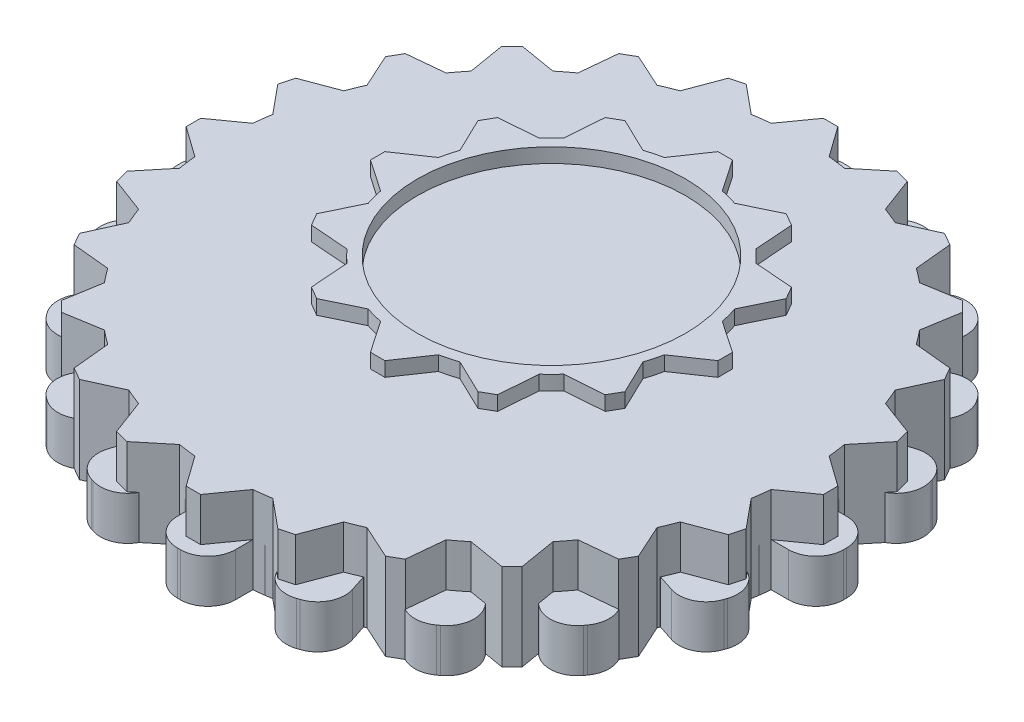
from build123d import *

# Parameters (mm, degrees)
BOSS_EXTRUDE3_DEPTH = 3
BOSS_EXTRUDE5_DEPTH = 6
BOSS_EXTRUDE6_DEPTH = 5.5
SKETCH6_R           = 9.25
BOSS_EXTRUDE7_DEPTH = 1.5


with BuildPart() as part:
    # Sketch2 → Boss-Extrude3 (new body)
    with BuildSketch(Plane(origin=(0, 0, 0), x_dir=(1, 0, 0), z_dir=(0, 1, 0))):
        with BuildLine():
            Line((-23, 0.1), (-23, -0.1))
            ThreePointArc((-23, -0.1), (-22.443502884, -1.443502884), (-21.1, -2))
            Line((-21.1, -2), (-19.899748742, -2))
            ThreePointArc((-19.899748742, -2), (-19.753766812, -3.128689301), (-19.543819703, -4.247247513))
            Line((-19.543819703, -4.247247513), (-20.685326483, -4.618145549))
            ThreePointArc((-20.685326483, -4.618145549), (-21.791106589, -5.56257098), (-21.905201574, -7.012285219))
            Line((-21.905201574, -7.012285219), (-21.843398175, -7.202496522))
            ThreePointArc((-21.843398175, -7.202496522), (-20.898972744, -8.308276629), (-19.449258505, -8.422371614))
            Line((-19.449258505, -8.422371614), (-18.307751725, -8.051473578))
            ThreePointArc((-18.307751725, -8.051473578), (-17.820130484, -9.079809995), (-17.274805421, -10.078744846))
            Line((-17.274805421, -10.078744846), (-18.245829086, -10.784234835))
            ThreePointArc((-18.245829086, -10.784234835), (-19.005644954, -12.02414164), (-18.666169396, -13.438159103))
            Line((-18.666169396, -13.438159103), (-18.548612345, -13.599962502))
            ThreePointArc((-18.548612345, -13.599962502), (-17.30870554, -14.35977837), (-15.894688077, -14.020302812))
            Line((-15.894688077, -14.020302812), (-14.923664412, -13.314812824))
            ThreePointArc((-14.923664412, -13.314812824), (-14.142135624, -14.142135624), (-13.314812824, -14.923664412))
            Line((-13.314812824, -14.923664412), (-14.020302812, -15.894688077))
            ThreePointArc((-14.020302812, -15.894688077), (-14.35977837, -17.30870554), (-13.599962502, -18.548612345))
            Line((-13.599962502, -18.548612345), (-13.438159103, -18.666169396))
            ThreePointArc((-13.438159103, -18.666169396), (-12.02414164, -19.005644954), (-10.784234835, -18.245829086))
            Line((-10.784234835, -18.245829086), (-10.078744846, -17.274805421))
            ThreePointArc((-10.078744846, -17.274805421), (-9.079809995, -17.820130484), (-8.051473578, -18.307751725))
            Line((-8.051473578, -18.307751725), (-8.422371614, -19.449258505))
            ThreePointArc((-8.422371614, -19.449258505), (-8.308276629, -20.898972744), (-7.202496522, -21.843398175))
            Line((-7.202496522, -21.843398175), (-7.012285219, -21.905201574))
            ThreePointArc((-7.012285219, -21.905201574), (-5.56257098, -21.791106589), (-4.618145549, -20.685326483))
            Line((-4.618145549, -20.685326483), (-4.247247513, -19.543819703))
            ThreePointArc((-4.247247513, -19.543819703), (-3.128689301, -19.753766812), (-2, -19.899748742))
            Line((-2, -19.899748742), (-2, -21.1))
            ThreePointArc((-2, -21.1), (-1.443502884, -22.443502884), (-0.1, -23))
            Line((-0.1, -23), (0.1, -23))
            ThreePointArc((0.1, -23), (1.443502884, -22.443502884), (2, -21.1))
            Line((2, -21.1), (2, -19.899748742))
            ThreePointArc((2, -19.899748742), (3.128689301, -19.753766812), (4.247247513, -19.543819703))
            Line((4.247247513, -19.543819703), (4.618145549, -20.685326483))
            ThreePointArc((4.618145549, -20.685326483), (5.56257098, -21.791106589), (7.012285219, -21.905201574))
            Line((7.012285219, -21.905201574), (7.202496522, -21.843398175))
            ThreePointArc((7.202496522, -21.843398175), (8.308276629, -20.898972744), (8.422371614, -19.449258505))
            Line((8.422371614, -19.449258505), (8.051473578, -18.307751725))
            ThreePointArc((8.051473578, -18.307751725), (9.079809995, -17.820130484), (10.078744846, -17.274805421))
            Line((10.078744846, -17.274805421), (10.784234835, -18.245829086))
            ThreePointArc((10.784234835, -18.245829086), (12.02414164, -19.005644954), (13.438159103, -18.666169396))
            Line((13.438159103, -18.666169396), (13.599962502, -18.548612345))
            ThreePointArc((13.599962502, -18.548612345), (14.35977837, -17.30870554), (14.020302812, -15.894688077))
            Line((14.020302812, -15.894688077), (13.314812824, -14.923664412))
            ThreePointArc((13.314812824, -14.923664412), (14.142135624, -14.142135624), (14.923664412, -13.314812824))
            Line((14.923664412, -13.314812824), (15.894688077, -14.020302812))
            ThreePointArc((15.894688077, -14.020302812), (17.30870554, -14.35977837), (18.548612345, -13.599962502))
            Line((18.548612345, -13.599962502), (18.666169396, -13.438159103))
            ThreePointArc((18.666169396, -13.438159103), (19.005644954, -12.02414164), (18.245829086, -10.784234835))
            Line((18.245829086, -10.784234835), (17.274805421, -10.078744846))
            ThreePointArc((17.274805421, -10.078744846), (17.820130484, -9.079809995), (18.307751725, -8.051473578))
            Line((18.307751725, -8.051473578), (19.449258505, -8.422371614))
            ThreePointArc((19.449258505, -8.422371614), (20.898972744, -8.308276629), (21.843398175, -7.202496522))
            Line((21.843398175, -7.202496522), (21.905201574, -7.012285219))
            ThreePointArc((21.905201574, -7.012285219), (21.791106589, -5.56257098), (20.685326483, -4.618145549))
            Line((20.685326483, -4.618145549), (19.543819703, -4.247247513))
            ThreePointArc((19.543819703, -4.247247513), (19.753766812, -3.128689301), (19.899748742, -2))
            Line((19.899748742, -2), (21.1, -2))
            ThreePointArc((21.1, -2), (22.443502884, -1.443502884), (23, -0.1))
            Line((23, -0.1), (23, 0.1))
            ThreePointArc((23, 0.1), (22.443502884, 1.443502884), (21.1, 2))
            Line((21.1, 2), (19.899748742, 2))
            ThreePointArc((19.899748742, 2), (19.753766812, 3.128689301), (19.543819703, 4.247247513))
            Line((19.543819703, 4.247247513), (20.685326483, 4.618145549))
            ThreePointArc((20.685326483, 4.618145549), (21.791106589, 5.56257098), (21.905201574, 7.012285219))
            Line((21.905201574, 7.012285219), (21.843398175, 7.202496522))
            ThreePointArc((21.843398175, 7.202496522), (20.898972744, 8.308276629), (19.449258505, 8.422371614))
            Line((19.449258505, 8.422371614), (18.307751725, 8.051473578))
            ThreePointArc((18.307751725, 8.051473578), (17.820130484, 9.079809995), (17.274805421, 10.078744846))
            Line((17.274805421, 10.078744846), (18.245829086, 10.784234835))
            ThreePointArc((18.245829086, 10.784234835), (19.005644954, 12.02414164), (18.666169396, 13.438159103))
            Line((18.666169396, 13.438159103), (18.548612345, 13.599962502))
            ThreePointArc((18.548612345, 13.599962502), (17.30870554, 14.35977837), (15.894688077, 14.020302812))
            Line((15.894688077, 14.020302812), (14.923664412, 13.314812824))
            ThreePointArc((14.923664412, 13.314812824), (14.142135624, 14.142135624), (13.314812824, 14.923664412))
            Line((13.314812824, 14.923664412), (14.020302812, 15.894688077))
            ThreePointArc((14.020302812, 15.894688077), (14.35977837, 17.30870554), (13.599962502, 18.548612345))
            Line((13.599962502, 18.548612345), (13.438159103, 18.666169396))
            ThreePointArc((13.438159103, 18.666169396), (12.02414164, 19.005644954), (10.784234835, 18.245829086))
            Line((10.784234835, 18.245829086), (10.078744846, 17.274805421))
            ThreePointArc((10.078744846, 17.274805421), (9.079809995, 17.820130484), (8.051473578, 18.307751725))
            Line((8.051473578, 18.307751725), (8.422371614, 19.449258505))
            ThreePointArc((8.422371614, 19.449258505), (8.308276629, 20.898972744), (7.202496522, 21.843398175))
            Line((7.202496522, 21.843398175), (7.012285219, 21.905201574))
            ThreePointArc((7.012285219, 21.905201574), (5.56257098, 21.791106589), (4.618145549, 20.685326483))
            Line((4.618145549, 20.685326483), (4.247247513, 19.543819703))
            ThreePointArc((4.247247513, 19.543819703), (3.128689301, 19.753766812), (2, 19.899748742))
            Line((2, 19.899748742), (2, 21.1))
            ThreePointArc((2, 21.1), (1.443502884, 22.443502884), (0.1, 23))
            Line((0.1, 23), (-0.1, 23))
            ThreePointArc((-0.1, 23), (-1.443502884, 22.443502884), (-2, 21.1))
            Line((-2, 21.1), (-2, 19.899748742))
            ThreePointArc((-2, 19.899748742), (-3.128689301, 19.753766812), (-4.247247513, 19.543819703))
            Line((-4.247247513, 19.543819703), (-4.618145549, 20.685326483))
            ThreePointArc((-4.618145549, 20.685326483), (-5.56257098, 21.791106589), (-7.012285219, 21.905201574))
            Line((-7.012285219, 21.905201574), (-7.202496522, 21.843398175))
            ThreePointArc((-7.202496522, 21.843398175), (-8.308276629, 20.898972744), (-8.422371614, 19.449258505))
            Line((-8.422371614, 19.449258505), (-8.051473578, 18.307751725))
            ThreePointArc((-8.051473578, 18.307751725), (-9.079809995, 17.820130484), (-10.078744846, 17.274805421))
            Line((-10.078744846, 17.274805421), (-10.784234835, 18.245829086))
            ThreePointArc((-10.784234835, 18.245829086), (-12.02414164, 19.005644954), (-13.438159103, 18.666169396))
            Line((-13.438159103, 18.666169396), (-13.599962502, 18.548612345))
            ThreePointArc((-13.599962502, 18.548612345), (-14.35977837, 17.30870554), (-14.020302812, 15.894688077))
            Line((-14.020302812, 15.894688077), (-13.314812824, 14.923664412))
            ThreePointArc((-13.314812824, 14.923664412), (-14.142135624, 14.142135624), (-14.923664412, 13.314812824))
            Line((-14.923664412, 13.314812824), (-15.894688077, 14.020302812))
            ThreePointArc((-15.894688077, 14.020302812), (-17.30870554, 14.35977837), (-18.548612345, 13.599962502))
            Line((-18.548612345, 13.599962502), (-18.666169396, 13.438159103))
            ThreePointArc((-18.666169396, 13.438159103), (-19.005644954, 12.02414164), (-18.245829086, 10.784234835))
            Line((-18.245829086, 10.784234835), (-17.274805421, 10.078744846))
            ThreePointArc((-17.274805421, 10.078744846), (-17.820130484, 9.079809995), (-18.307751725, 8.051473578))
            Line((-18.307751725, 8.051473578), (-19.449258505, 8.422371614))
            ThreePointArc((-19.449258505, 8.422371614), (-20.898972744, 8.308276629), (-21.843398175, 7.202496522))
            Line((-21.843398175, 7.202496522), (-21.905201574, 7.012285219))
            ThreePointArc((-21.905201574, 7.012285219), (-21.791106589, 5.56257098), (-20.685326483, 4.618145549))
            Line((-20.685326483, 4.618145549), (-19.543819703, 4.247247513))
            ThreePointArc((-19.543819703, 4.247247513), (-19.753766812, 3.128689301), (-19.899748742, 2))
            Line((-19.899748742, 2), (-21.1, 2))
            ThreePointArc((-21.1, 2), (-22.443502884, 1.443502884), (-23, 0.1))
        make_face()
    extrude(amount=BOSS_EXTRUDE3_DEPTH)


with BuildPart() as body_2:
    # Sketch3 → Boss-Extrude5 (new body)
    with BuildSketch(Plane(origin=(0, 0, 0), x_dir=(1, 0, 0), z_dir=(0, 1, 0))):
        with BuildLine():
            Line((-22, 0.5), (-22, -0.5))
            Line((-22, -0.5), (-19.899748742, -2))
            ThreePointArc((-19.899748742, -2), (-19.828897227, -2.610523844), (-19.739319337, -3.218582315))
            Line((-19.739319337, -3.218582315), (-21.379777701, -5.211056079))
            Line((-21.379777701, -5.211056079), (-21.120958656, -6.176981905))
            Line((-21.120958656, -6.176981905), (-18.704043156, -7.08228562))
            ThreePointArc((-18.704043156, -7.08228562), (-18.47759065, -7.653668647), (-18.23368794, -8.217823563))
            Line((-18.23368794, -8.217823563), (-19.302558883, -10.566987298))
            Line((-19.302558883, -10.566987298), (-18.802558883, -11.433012702))
            Line((-18.802558883, -11.433012702), (-16.23368794, -11.681925179))
            ThreePointArc((-16.23368794, -11.681925179), (-15.867066806, -12.17522858), (-15.485460842, -12.657033717))
            Line((-15.485460842, -12.657033717), (-15.909902577, -15.202795796))
            Line((-15.909902577, -15.202795796), (-15.202795796, -15.909902577))
            Line((-15.202795796, -15.909902577), (-12.657033717, -15.485460842))
            ThreePointArc((-12.657033717, -15.485460842), (-12.17522858, -15.867066806), (-11.681925179, -16.23368794))
            Line((-11.681925179, -16.23368794), (-11.433012702, -18.802558883))
            Line((-11.433012702, -18.802558883), (-10.566987298, -19.302558883))
            Line((-10.566987298, -19.302558883), (-8.217823563, -18.23368794))
            ThreePointArc((-8.217823563, -18.23368794), (-7.653668647, -18.47759065), (-7.08228562, -18.704043156))
            Line((-7.08228562, -18.704043156), (-6.176981905, -21.120958656))
            Line((-6.176981905, -21.120958656), (-5.211056079, -21.379777701))
            Line((-5.211056079, -21.379777701), (-3.218582315, -19.739319337))
            ThreePointArc((-3.218582315, -19.739319337), (-2.610523844, -19.828897227), (-2, -19.899748742))
            Line((-2, -19.899748742), (-0.5, -22))
            Line((-0.5, -22), (0.5, -22))
            Line((0.5, -22), (2, -19.899748742))
            ThreePointArc((2, -19.899748742), (2.610523844, -19.828897227), (3.218582315, -19.739319337))
            Line((3.218582315, -19.739319337), (5.211056079, -21.379777701))
            Line((5.211056079, -21.379777701), (6.176981905, -21.120958656))
            Line((6.176981905, -21.120958656), (7.08228562, -18.704043156))
            ThreePointArc((7.08228562, -18.704043156), (7.653668647, -18.47759065), (8.217823563, -18.23368794))
            Line((8.217823563, -18.23368794), (10.566987298, -19.302558883))
            Line((10.566987298, -19.302558883), (11.433012702, -18.802558883))
            Line((11.433012702, -18.802558883), (11.681925179, -16.23368794))
            ThreePointArc((11.681925179, -16.23368794), (12.17522858, -15.867066806), (12.657033717, -15.485460842))
            Line((12.657033717, -15.485460842), (15.202795796, -15.909902577))
            Line((15.202795796, -15.909902577), (15.909902577, -15.202795796))
            Line((15.909902577, -15.202795796), (15.485460842, -12.657033717))
            ThreePointArc((15.485460842, -12.657033717), (15.867066806, -12.17522858), (16.23368794, -11.681925179))
            Line((16.23368794, -11.681925179), (18.802558883, -11.433012702))
            Line((18.802558883, -11.433012702), (19.302558883, -10.566987298))
            Line((19.302558883, -10.566987298), (18.23368794, -8.217823563))
            ThreePointArc((18.23368794, -8.217823563), (18.47759065, -7.653668647), (18.704043156, -7.08228562))
            Line((18.704043156, -7.08228562), (21.120958656, -6.176981905))
            Line((21.120958656, -6.176981905), (21.379777701, -5.211056079))
            Line((21.379777701, -5.211056079), (19.739319337, -3.218582315))
            ThreePointArc((19.739319337, -3.218582315), (19.828897227, -2.610523844), (19.899748742, -2))
            Line((19.899748742, -2), (22, -0.5))
            Line((22, -0.5), (22, 0.5))
            Line((22, 0.5), (19.899748742, 2))
            ThreePointArc((19.899748742, 2), (19.828897227, 2.610523844), (19.739319337, 3.218582315))
            Line((19.739319337, 3.218582315), (21.379777701, 5.211056079))
            Line((21.379777701, 5.211056079), (21.120958656, 6.176981905))
            Line((21.120958656, 6.176981905), (18.704043156, 7.08228562))
            ThreePointArc((18.704043156, 7.08228562), (18.47759065, 7.653668647), (18.23368794, 8.217823563))
            Line((18.23368794, 8.217823563), (19.302558883, 10.566987298))
            Line((19.302558883, 10.566987298), (18.802558883, 11.433012702))
            Line((18.802558883, 11.433012702), (16.23368794, 11.681925179))
            ThreePointArc((16.23368794, 11.681925179), (15.867066806, 12.17522858), (15.485460842, 12.657033717))
            Line((15.485460842, 12.657033717), (15.909902577, 15.202795796))
            Line((15.909902577, 15.202795796), (15.202795796, 15.909902577))
            Line((15.202795796, 15.909902577), (12.657033717, 15.485460842))
            ThreePointArc((12.657033717, 15.485460842), (12.17522858, 15.867066806), (11.681925179, 16.23368794))
            Line((11.681925179, 16.23368794), (11.433012702, 18.802558883))
            Line((11.433012702, 18.802558883), (10.566987298, 19.302558883))
            Line((10.566987298, 19.302558883), (8.217823563, 18.23368794))
            ThreePointArc((8.217823563, 18.23368794), (7.653668647, 18.47759065), (7.08228562, 18.704043156))
            Line((7.08228562, 18.704043156), (6.176981905, 21.120958656))
            Line((6.176981905, 21.120958656), (5.211056079, 21.379777701))
            Line((5.211056079, 21.379777701), (3.218582315, 19.739319337))
            ThreePointArc((3.218582315, 19.739319337), (2.610523844, 19.828897227), (2, 19.899748742))
            Line((2, 19.899748742), (0.5, 22))
            Line((0.5, 22), (-0.5, 22))
            Line((-0.5, 22), (-2, 19.899748742))
            ThreePointArc((-2, 19.899748742), (-2.610523844, 19.828897227), (-3.218582315, 19.739319337))
            Line((-3.218582315, 19.739319337), (-5.211056079, 21.379777701))
            Line((-5.211056079, 21.379777701), (-6.176981905, 21.120958656))
            Line((-6.176981905, 21.120958656), (-7.08228562, 18.704043156))
            ThreePointArc((-7.08228562, 18.704043156), (-7.653668647, 18.47759065), (-8.217823563, 18.23368794))
            Line((-8.217823563, 18.23368794), (-10.566987298, 19.302558883))
            Line((-10.566987298, 19.302558883), (-11.433012702, 18.802558883))
            Line((-11.433012702, 18.802558883), (-11.681925179, 16.23368794))
            ThreePointArc((-11.681925179, 16.23368794), (-12.17522858, 15.867066806), (-12.657033717, 15.485460842))
            Line((-12.657033717, 15.485460842), (-15.202795796, 15.909902577))
            Line((-15.202795796, 15.909902577), (-15.909902577, 15.202795796))
            Line((-15.909902577, 15.202795796), (-15.485460842, 12.657033717))
            ThreePointArc((-15.485460842, 12.657033717), (-15.867066806, 12.17522858), (-16.23368794, 11.681925179))
            Line((-16.23368794, 11.681925179), (-18.802558883, 11.433012702))
            Line((-18.802558883, 11.433012702), (-19.302558883, 10.566987298))
            Line((-19.302558883, 10.566987298), (-18.23368794, 8.217823563))
            ThreePointArc((-18.23368794, 8.217823563), (-18.47759065, 7.653668647), (-18.704043156, 7.08228562))
            Line((-18.704043156, 7.08228562), (-21.120958656, 6.176981905))
            Line((-21.120958656, 6.176981905), (-21.379777701, 5.211056079))
            Line((-21.379777701, 5.211056079), (-19.739319337, 3.218582315))
            ThreePointArc((-19.739319337, 3.218582315), (-19.828897227, 2.610523844), (-19.899748742, 2))
            Line((-19.899748742, 2), (-22, 0.5))
        make_face()
    extrude(amount=BOSS_EXTRUDE5_DEPTH)


with BuildPart() as body_3:
    # Sketch1 → Boss-Extrude6 (new body)
    with BuildSketch(Plane(origin=(0, 0, 0), x_dir=(1, 0, 0), z_dir=(0, 1, 0))):
        with BuildLine():
            Line((-1.142396869, 15.366895677), (-0.142396869, 15.366895677))
            Line((-0.142396869, 15.366895677), (1.357603131, 13.164854648))
            ThreePointArc((1.357603131, 13.164854648), (1.945793582, 13.026153939), (2.524531809, 12.852177051))
            Line((2.524531809, 12.852177051), (4.924590429, 14.009200522))
            Line((4.924590429, 14.009200522), (5.790615833, 13.509200522))
            Line((5.790615833, 13.509200522), (5.988633424, 10.852177051))
            ThreePointArc((5.988633424, 10.852177051), (6.428670943, 10.437963488), (6.842884505, 9.99792597))
            Line((6.842884505, 9.99792597), (9.499907976, 9.799908378))
            Line((9.499907976, 9.799908378), (9.999907976, 8.933882975))
            Line((9.999907976, 8.933882975), (8.842884505, 6.533824355))
            ThreePointArc((8.842884505, 6.533824355), (9.016861394, 5.955086128), (9.155562102, 5.366895677))
            Line((9.155562102, 5.366895677), (11.357603131, 3.866895677))
            Line((11.357603131, 3.866895677), (11.357603131, 2.866895677))
            Line((11.357603131, 2.866895677), (9.155562102, 1.366895677))
            ThreePointArc((9.155562102, 1.366895677), (9.016861394, 0.778705226), (8.842884505, 0.199966999))
            Line((8.842884505, 0.199966999), (9.999907976, -2.200091622))
            Line((9.999907976, -2.200091622), (9.499907976, -3.066117025))
            Line((9.499907976, -3.066117025), (6.842884505, -3.264134617))
            ThreePointArc((6.842884505, -3.264134617), (6.428670943, -3.704172135), (5.988633424, -4.118385698))
            Line((5.988633424, -4.118385698), (5.790615833, -6.775409169))
            Line((5.790615833, -6.775409169), (4.924590429, -7.275409169))
            Line((4.924590429, -7.275409169), (2.524531809, -6.118385698))
            ThreePointArc((2.524531809, -6.118385698), (1.945793582, -6.292362586), (1.357603131, -6.431063295))
            Line((1.357603131, -6.431063295), (-0.142396869, -8.633104323))
            Line((-0.142396869, -8.633104323), (-1.142396869, -8.633104323))
            Line((-1.142396869, -8.633104323), (-2.642396869, -6.431063295))
            ThreePointArc((-2.642396869, -6.431063295), (-3.23058732, -6.292362586), (-3.809325547, -6.118385698))
            Line((-3.809325547, -6.118385698), (-6.209384167, -7.275409169))
            Line((-6.209384167, -7.275409169), (-7.075409571, -6.775409169))
            Line((-7.075409571, -6.775409169), (-7.273427162, -4.118385698))
            ThreePointArc((-7.273427162, -4.118385698), (-7.713464681, -3.704172135), (-8.127678243, -3.264134617))
            Line((-8.127678243, -3.264134617), (-10.784701714, -3.066117025))
            Line((-10.784701714, -3.066117025), (-11.284701714, -2.200091622))
            Line((-11.284701714, -2.200091622), (-10.127678243, 0.199966999))
            ThreePointArc((-10.127678243, 0.199966999), (-10.301655132, 0.778705226), (-10.44035584, 1.366895677))
            Line((-10.44035584, 1.366895677), (-12.642396869, 2.866895677))
            Line((-12.642396869, 2.866895677), (-12.642396869, 3.866895677))
            Line((-12.642396869, 3.866895677), (-10.44035584, 5.366895677))
            ThreePointArc((-10.44035584, 5.366895677), (-10.301655132, 5.955086128), (-10.127678243, 6.533824355))
            Line((-10.127678243, 6.533824355), (-11.284701714, 8.933882975))
            Line((-11.284701714, 8.933882975), (-10.784701714, 9.799908378))
            Line((-10.784701714, 9.799908378), (-8.127678243, 9.99792597))
            ThreePointArc((-8.127678243, 9.99792597), (-7.713464681, 10.437963488), (-7.273427162, 10.852177051))
            Line((-7.273427162, 10.852177051), (-7.075409571, 13.509200522))
            Line((-7.075409571, 13.509200522), (-6.209384167, 14.009200522))
            Line((-6.209384167, 14.009200522), (-3.809325547, 12.852177051))
            ThreePointArc((-3.809325547, 12.852177051), (-3.23058732, 13.026153939), (-2.642396869, 13.164854648))
            Line((-2.642396869, 13.164854648), (-1.142396869, 15.366895677))
        make_face()
        with BuildLine():
            Line((-2.642396869, 4.866895677), (1.357603131, 4.866895677))
            ThreePointArc((1.357603131, 4.866895677), (1.857603131, 3.366895677), (1.357603131, 1.866895677))
            Line((1.357603131, 1.866895677), (-2.642396869, 1.866895677))
            ThreePointArc((-2.642396869, 1.866895677), (-3.142396869, 3.366895677), (-2.642396869, 4.866895677))
        make_face(mode=Mode.SUBTRACT)
    extrude(amount=BOSS_EXTRUDE6_DEPTH)

    # Sketch6 → Boss-Extrude7 (add)
    with BuildSketch(Plane(origin=(0, 5.5, 0), x_dir=(1, 0, 0), z_dir=(0, 1, 0))):
        with BuildLine():
            Line((-1.142396869, 15.366895677), (-2.642396869, 13.164854648))
            ThreePointArc((-2.642396869, 13.164854648), (-3.23058732, 13.026153939), (-3.809325547, 12.852177051))
            Line((-3.809325547, 12.852177051), (-6.209384167, 14.009200522))
            Line((-6.209384167, 14.009200522), (-7.075409571, 13.509200522))
            Line((-7.075409571, 13.509200522), (-7.273427162, 10.852177051))
            ThreePointArc((-7.273427162, 10.852177051), (-7.713464681, 10.437963488), (-8.127678243, 9.99792597))
            Line((-8.127678243, 9.99792597), (-10.784701714, 9.799908378))
            Line((-10.784701714, 9.799908378), (-11.284701714, 8.933882975))
            Line((-11.284701714, 8.933882975), (-10.127678243, 6.533824355))
            ThreePointArc((-10.127678243, 6.533824355), (-10.301655132, 5.955086128), (-10.44035584, 5.366895677))
            Line((-10.44035584, 5.366895677), (-12.642396869, 3.866895677))
            Line((-12.642396869, 3.866895677), (-12.642396869, 2.866895677))
            Line((-12.642396869, 2.866895677), (-10.44035584, 1.366895677))
            ThreePointArc((-10.44035584, 1.366895677), (-10.301655132, 0.778705226), (-10.127678243, 0.199966999))
            Line((-10.127678243, 0.199966999), (-11.284701714, -2.200091622))
            Line((-11.284701714, -2.200091622), (-10.784701714, -3.066117025))
            Line((-10.784701714, -3.066117025), (-8.127678243, -3.264134617))
            ThreePointArc((-8.127678243, -3.264134617), (-7.713464681, -3.704172135), (-7.273427162, -4.118385698))
            Line((-7.273427162, -4.118385698), (-7.075409571, -6.775409169))
            Line((-7.075409571, -6.775409169), (-6.209384167, -7.275409169))
            Line((-6.209384167, -7.275409169), (-3.809325547, -6.118385698))
            ThreePointArc((-3.809325547, -6.118385698), (-3.23058732, -6.292362586), (-2.642396869, -6.431063295))
            Line((-2.642396869, -6.431063295), (-1.142396869, -8.633104323))
            Line((-1.142396869, -8.633104323), (-0.142396869, -8.633104323))
            Line((-0.142396869, -8.633104323), (1.357603131, -6.431063295))
            ThreePointArc((1.357603131, -6.431063295), (1.945793582, -6.292362586), (2.524531809, -6.118385698))
            Line((2.524531809, -6.118385698), (4.924590429, -7.275409169))
            Line((4.924590429, -7.275409169), (5.790615833, -6.775409169))
            Line((5.790615833, -6.775409169), (5.988633424, -4.118385698))
            ThreePointArc((5.988633424, -4.118385698), (6.428670943, -3.704172135), (6.842884505, -3.264134617))
            Line((6.842884505, -3.264134617), (9.499907976, -3.066117025))
            Line((9.499907976, -3.066117025), (9.999907976, -2.200091622))
            Line((9.999907976, -2.200091622), (8.842884505, 0.199966999))
            ThreePointArc((8.842884505, 0.199966999), (9.016861394, 0.778705226), (9.155562102, 1.366895677))
            Line((9.155562102, 1.366895677), (11.357603131, 2.866895677))
            Line((11.357603131, 2.866895677), (11.357603131, 3.866895677))
            Line((11.357603131, 3.866895677), (9.155562102, 5.366895677))
            ThreePointArc((9.155562102, 5.366895677), (9.016861394, 5.955086128), (8.842884505, 6.533824355))
            Line((8.842884505, 6.533824355), (9.999907976, 8.933882975))
            Line((9.999907976, 8.933882975), (9.499907976, 9.799908378))
            Line((9.499907976, 9.799908378), (6.842884505, 9.99792597))
            ThreePointArc((6.842884505, 9.99792597), (6.428670943, 10.437963488), (5.988633424, 10.852177051))
            Line((5.988633424, 10.852177051), (5.790615833, 13.509200522))
            Line((5.790615833, 13.509200522), (4.924590429, 14.009200522))
            Line((4.924590429, 14.009200522), (2.524531809, 12.852177051))
            ThreePointArc((2.524531809, 12.852177051), (1.945793582, 13.026153939), (1.357603131, 13.164854648))
            Line((1.357603131, 13.164854648), (-0.142396869, 15.366895677))
            Line((-0.142396869, 15.366895677), (-1.142396869, 15.366895677))
        make_face()
        with Locations((-0.642396869, 3.366895677)):
            Circle(SKETCH6_R, mode=Mode.SUBTRACT)
    extrude(amount=BOSS_EXTRUDE7_DEPTH)


solid = Compound([part.part, body_2.part, body_3.part])
